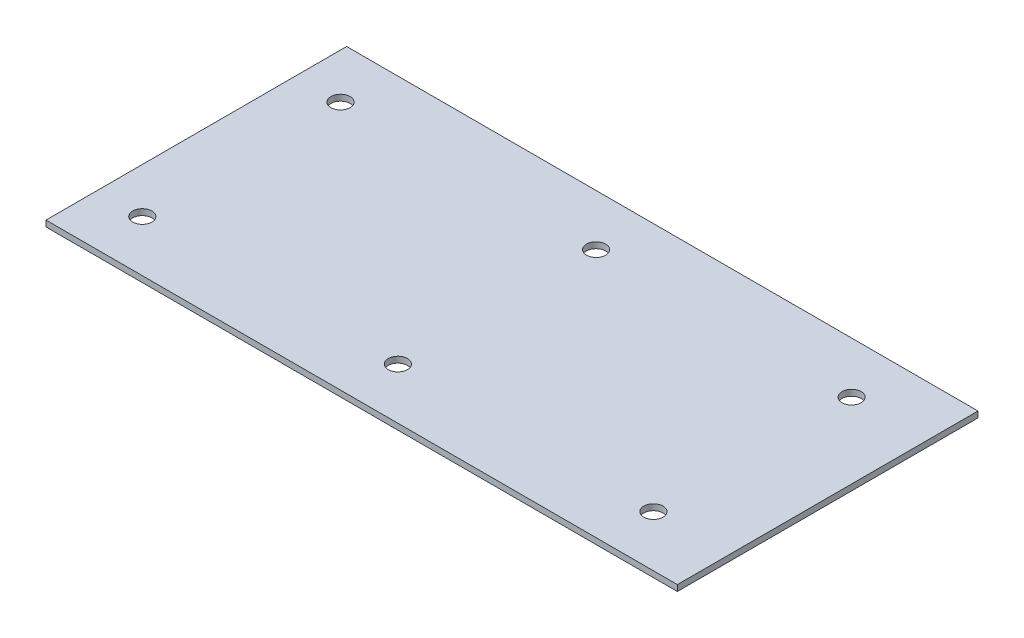
from build123d import *

# Parameters (mm, degrees)
SKETCH_1_W      = 210
SKETCH_1_H      = 100
SKETCH_1_R      = 3.2
EXTRUDE_1_DEPTH = 2


with BuildPart() as part:
    # Эскиз1 → Бобышка-Вытянуть1 (new body)
    with BuildSketch(Plane(origin=(0, 0, 0), x_dir=(1, 0, 0), z_dir=(0, 1, 0))):
        with Locations((105, 50)):
            Rectangle(SKETCH_1_W, SKETCH_1_H)
        with Locations((185, 17.034247801)):
            Circle(SKETCH_1_R, mode=Mode.SUBTRACT)
        with Locations((100, 17.034247801)):
            Circle(SKETCH_1_R, mode=Mode.SUBTRACT)
        with Locations((15, 17.034247801)):
            Circle(SKETCH_1_R, mode=Mode.SUBTRACT)
        with Locations((185, 82.965752199)):
            Circle(SKETCH_1_R, mode=Mode.SUBTRACT)
        with Locations((100, 82.965752199)):
            Circle(SKETCH_1_R, mode=Mode.SUBTRACT)
        with Locations((15, 82.965752199)):
            Circle(SKETCH_1_R, mode=Mode.SUBTRACT)
    extrude(amount=EXTRUDE_1_DEPTH)


solid = part.part
